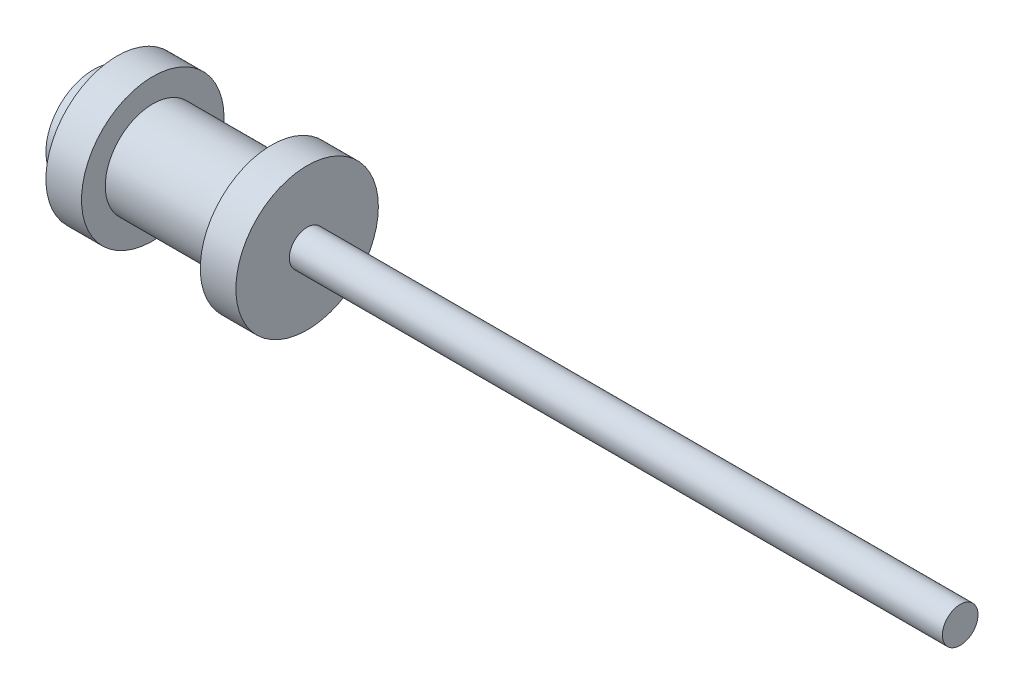
from build123d import *


with BuildPart() as part:
    # Sketch1 → Revolve1 (revolve)
    with BuildSketch(Plane.XY):
        Polygon((0, -4), (0, -6), (3, -6), (3, -4), (13, -4), (13, -6), (16, -6), (16, -1.5), (71, -1.5), (71, 0), (0, 0), (-2, 0), (-2, -4), align=None)
    revolve(axis=Axis((71, 0, 0), (-1, 0, 0)))


solid = part.part
